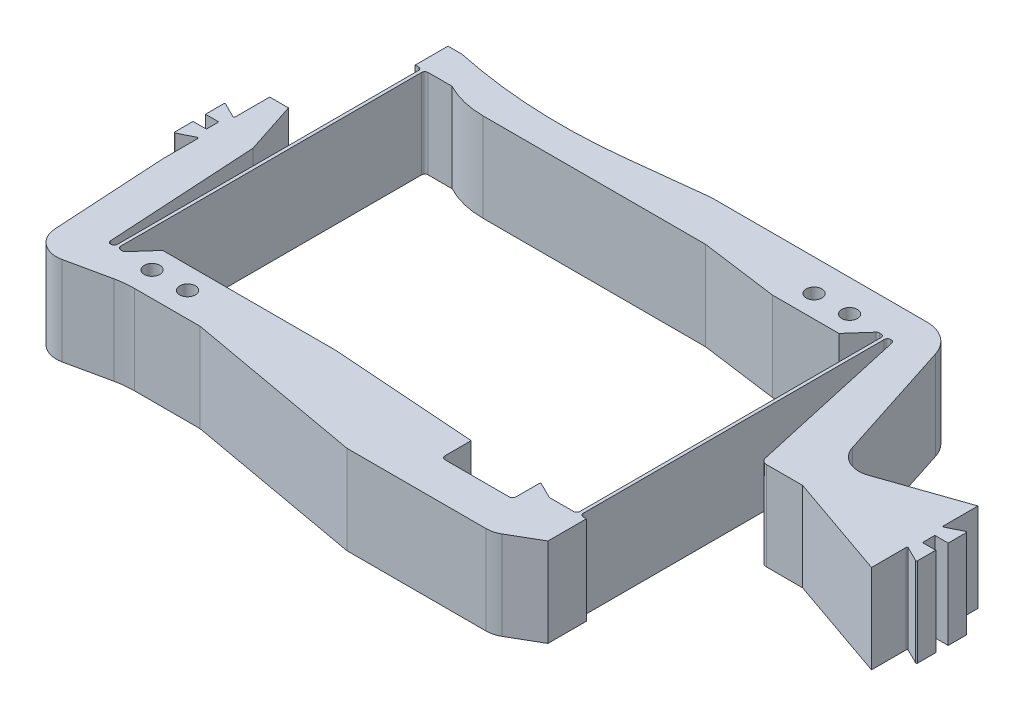
from build123d import *

# Parameters (mm, degrees)
BOSS_EXTRUDE1_DEPTH        = 6.35
BOSS_EXTRUDE1_DEPTH_BACK   = 6.35
BOSS_EXTRUDE1_2_DEPTH      = 6.35
BOSS_EXTRUDE1_2_DEPTH_BACK = 6.35
BOSS_EXTRUDE2_DEPTH        = 6.35
BOSS_EXTRUDE2_DEPTH_BACK   = 6.35
SKETCH3_W                  = 0.4572
SKETCH3_H                  = 44.508
BOSS_EXTRUDE4_DEPTH        = 6.35
BOSS_EXTRUDE4_DEPTH_BACK   = 6.35
SKETCH8_W                  = 2.032
SKETCH8_H                  = 1.778
CUT_EXTRUDE1_DEPTH         = 63.522062345
FILLET1_R                  = 0.4572
FILLET2_R                  = 0.9144
FILLET3_R                  = 3.556
FILLET6_R                  = 12.7
SKETCH9_R                  = 1.1303
CUT_EXTRUDE2_DEPTH         = 63.522062345
FILLET7_R                  = 0.127
FILLET8_R                  = 0.508
FILLET9_R                  = 76.2
SKETCH12_W                 = 3.975578287
SKETCH12_H                 = 4.68929279
SKETCH12_W_2               = 5.470600001
SKETCH12_H_2               = 8.387314833
CUT_EXTRUDE3_DEPTH         = 63.522062345
FILLET10_R                 = 0.127


with BuildPart() as part:
    # Sketch2 → Boss-Extrude1 (new, two sides: drawn at the far end of the back side and taken through both)
    with BuildSketch(Plane(origin=(0, 0, 0), x_dir=(1, 0, 0), z_dir=(0, 1, 0)).offset(-BOSS_EXTRUDE1_DEPTH_BACK)):
        with BuildLine():
            Line((9.819911786, 19.050210052), (19.344911786, 19.050210052))
            Line((19.344911786, 19.050210052), (21.965511899, 22))
            Line((21.965511899, 22), (24.251511899, 22))
            Line((24.251511899, 22), (29.687111899, -2.381342584))
            Line((29.687111899, -2.381342584), (35.584296061, -2.381342584))
            Line((35.584296061, -2.381342584), (50.68062, -7.62))
            Line((50.68062, -7.62), (50.68062, 7.62))
            Line((50.68062, 7.62), (35.584296061, 2.381342584))
            Line((35.584296061, 2.381342584), (28.784210924, 23.462125012))
            ThreePointArc((28.784210924, 23.462125012), (27.055039043, 25.850117603), (24.251511899, 26.762685167))
            Line((24.251511899, 26.762685167), (-6.638632099, 26.762685167))
            Line((-6.638632099, 26.762685167), (-30.153140375, 24.092168337))
            Line((-30.153140375, 24.092168337), (-42.245281802, 26.68929279))
            Line((-42.245281802, 26.68929279), (-48.211266614, 26.68929279))
            Line((-48.211266614, 26.68929279), (-48.211266614, 22))
            Line((-48.211266614, 22), (-38.957383068, 22))
            Line((-38.957383068, 22), (-36.496303445, 20.550210052))
            Line((-36.496303445, 20.550210052), (-1.229088214, 20.550210052))
            Line((-1.229088214, 20.550210052), (9.819911786, 19.050210052))
        make_face()
    extrude(amount=BOSS_EXTRUDE1_DEPTH + BOSS_EXTRUDE1_DEPTH_BACK)



with BuildPart() as body_2:
    # Sketch2 → Boss-Extrude1 2 (new, two sides: drawn at the far end of the back side and taken through both)
    with BuildSketch(Plane(origin=(0, 0, 0), x_dir=(1, 0, 0), z_dir=(0, 1, 0)).offset(-BOSS_EXTRUDE1_2_DEPTH_BACK)):
        Polygon((-50.68062, 7.62), (-47.994229245, 7.62), (-45.538273994, 0.064709726), (-44.235688327, -22), (-41.949688327, -22), (-39.329088214, -19.050210052), (-14.524057774, -19.050210052), (6.319911674, -20.5502101), (6.319911674, -24.799314833), (16.494911898, -24.799314833), (16.494911898, -22), (16.494911898, -20.7842203), (18.962447951, -22), (29.7221119, -22), (29.7221119, -24.341022744), (19.249626804, -30.387314833), (-1.624639293, -30.387314833), (-27.239820872, -25.774174137), (-37.984514025, -25.774174137), (-49.463347649, -28.239573642), (-50.68062, -7.62), align=None)
    extrude(amount=BOSS_EXTRUDE1_2_DEPTH + BOSS_EXTRUDE1_2_DEPTH_BACK)


with BuildPart() as part_1:
    add(part.part)

    add(body_2.part)  # Boss-Extrude2 merges body 2
    # Sketch3 → Boss-Extrude2 (add, two sides: drawn at the far end of the back side and taken through both)
    with BuildSketch(Plane(origin=(0, 0, 0), x_dir=(1, 0, 0), z_dir=(0, 1, 0)).offset(-BOSS_EXTRUDE2_DEPTH_BACK)):
        with Locations((-43.092688327, 0.254)):
            Rectangle(SKETCH3_W, SKETCH3_H)
        with Locations((23.108511899, 0.254)):
            Rectangle(SKETCH3_W, SKETCH3_H)
    extrude(amount=BOSS_EXTRUDE2_DEPTH + BOSS_EXTRUDE2_DEPTH_BACK)

    # Sketch7 → Boss-Extrude4 (add, two sides: drawn at the far end of the back side and taken through both)
    with BuildSketch(Plane(origin=(0, 0, 0), x_dir=(1, 0, 0), z_dir=(0, 1, 0)).offset(-BOSS_EXTRUDE4_DEPTH_BACK)):
        Polygon((-53.14442, 3.68670581), (-53.14442, -3.68670581), (-50.75682, -2.49290581), (-50.68062, -2.45480581), (-50.68062, 2.45480581), (-50.75682, 2.49290581), align=None)
        Polygon((50.68062, 2.45480581), (50.68062, -2.45480581), (50.75682, -2.49290581), (53.14442, -3.68670581), (53.14442, 3.68670581), (50.75682, 2.49290581), align=None)
    extrude(amount=BOSS_EXTRUDE4_DEPTH + BOSS_EXTRUDE4_DEPTH_BACK)

    # Sketch8 → Cut-Extrude1 (cut, through all)
    with BuildSketch(Plane(origin=(0, 6.35, 0), x_dir=(1, 0, 0), z_dir=(0, 1, 0))):
        with Locations((-52.25542, 0)):
            Rectangle(SKETCH8_W, SKETCH8_H)
        with Locations((52.25542, 0)):
            Rectangle(SKETCH8_W, SKETCH8_H)
    extrude(amount=-CUT_EXTRUDE1_DEPTH, mode=Mode.SUBTRACT)

    # Fillet1
    fillet1_edges = [part_1.edges().sort_by_distance(p)[0] for p in [
        (-43.321288327, 0, -22),
        (24.251511899, 0, -22),
        (21.965511899, 0, -22),
        (-42.864088327, 0, -22),
        (23.337111899, 0, -22),
        (22.879911899, 0, -22),
        (22.879911899, 0, 22),
        (23.337111899, 0, 22),
        (-44.235688327, 0, 22),
        (-41.949688327, 0, 22),
        (-42.864088327, 0, 22),
        (-43.321288327, 0, 22),
    ]]
    fillet(fillet1_edges, radius=FILLET1_R)

    # Fillet2
    fillet2_edges = [part_1.edges().sort_by_distance(p)[0] for p in [
        (29.687111899, 0, 2.381342584),
        (-48.211266614, 0, -22),
        (-48.211266614, 0, -26.68929279),
        (29.7221119, 0, 22),
        (29.7221119, 0, 24.341022744),
    ]]
    fillet(fillet2_edges, radius=FILLET2_R)

    # Fillet3
    fillet3_edges = [part_1.edges().sort_by_distance(p)[0] for p in [
        (35.584296061, 0, -2.381342584),
        (19.249626804, 0, 30.387314833),
        (-49.463347649, 0, 28.239573642),
    ]]
    fillet(fillet3_edges, radius=FILLET3_R)

    # Fillet6
    # the kernel refuses this fillet: 12.7 mm, written as the material it adds along each edge
    with BuildSketch(Plane(origin=(-37.984514025, 6.35, 25.774174137), x_dir=(1, 0, 0), z_dir=(0, -1, 0))) as fillet6_piece_1:
        with BuildLine():
            CenterArc((FILLET6_R * 0.106178254311, FILLET6_R), FILLET6_R, 257.878284844, 12.121715156)
            Line((-FILLET6_R * 0.103810874318, FILLET6_R * 0.0222962791022), (0, 0))
            Line((0, 0), (FILLET6_R * 0.106178254311, 0))
        make_face()
    extrude(amount=12.7)
    # the kernel refuses this fillet: 12.7 mm, written as the material it takes off along each edge
    with BuildSketch(Plane(origin=(-36.496303445, 14.928809219, -20.550210052), x_dir=(-0.8616133508003352, 0, -0.507565201449645), z_dir=(0, -1, 0))) as fillet6_2_piece_1:
        with BuildLine():
            CenterArc((3.489431436, 12.684211567), FILLET6_R, 239.498215304, 27.644521231)
            Line((-2.956646623, 1.741722012), (0, 0))
            Line((0, 0), (2.856361988, 0))
        make_face()
    extrude(amount=29.857618438, mode=Mode.SUBTRACT)

    # Sketch9 → Cut-Extrude2 (cut, through all)
    with BuildSketch(Plane(origin=(0, 6.35, 0), x_dir=(1, 0, 0), z_dir=(0, 1, 0))):
        with Locations(Location((-37.678088214, -22.225210052, 0), (0, 0, 270))):
            Circle(SKETCH9_R)
        with Locations(Location((-32.598088214, -22.225210052, 0), (0, 0, 270))):
            Circle(SKETCH9_R)
        with Locations(Location((12.613911786, 22.225210052, 0), (0, 0, 270))):
            Circle(SKETCH9_R)
        with Locations(Location((17.693911786, 22.225210052, 0), (0, 0, 270))):
            Circle(SKETCH9_R)
    extrude(amount=-CUT_EXTRUDE2_DEPTH, mode=Mode.SUBTRACT)

    # Fillet7
    fillet7_edges = [part_1.edges().sort_by_distance(p)[0] for p in [
        (16.494911898, 0, 20.7842203),
    ]]
    fillet(fillet7_edges, radius=FILLET7_R)

    # Fillet8
    fillet8_edges = [part_1.edges().sort_by_distance(p)[0] for p in [
        (6.319911674, 0, 24.799314833),
        (16.494911898, 0, 24.799314833),
    ]]
    fillet(fillet8_edges, radius=FILLET8_R)

    # Fillet9
    # the kernel refuses this fillet: 76.2 mm, written as the material it adds along each edge
    with BuildSketch(Plane(origin=(-30.153140375, -6.35, -24.092168337), x_dir=(-0.9777037208978189, 0, -0.20998912862945954), z_dir=(0, 1, 0))) as fillet9_piece_1_section:
        with BuildLine():
            CenterArc((FILLET9_R * 0.16376499609, -FILLET9_R), FILLET9_R, 90, 18.600972695)
            Line((-FILLET9_R * 0.155210403169, -FILLET9_R * 0.0522370050125), (0, 0))
            Line((0, 0), (FILLET9_R * 0.16376499609, 0))
        make_face()
    fillet9_piece_1 = extrude(amount=12.7, mode=Mode.PRIVATE)
    fillet9_piece_1 = split(fillet9_piece_1, bisect_by=Plane(origin=(-30.153140375, -6.35, -26.68929279), z_dir=(0, 0, 1)), keep=Keep.TOP, mode=Mode.PRIVATE)
    add(fillet9_piece_1)

    # Sketch12 → Cut-Extrude3 (cut, through all)
    with BuildSketch(Plane(origin=(0, 6.35, 0), x_dir=(1, 0, 0), z_dir=(0, 1, 0))):
        with Locations((-46.223477471, 24.344646395)):
            Rectangle(SKETCH12_W, SKETCH12_H)
        with Locations((26.9868119, -26.193657417)):
            Rectangle(SKETCH12_W_2, SKETCH12_H_2)
    extrude(amount=-CUT_EXTRUDE3_DEPTH, mode=Mode.SUBTRACT)

    # Fillet10
    fillet10_edges = [part_1.edges().sort_by_distance(p)[0] for p in [
        (50.68062, 0, -2.45480581),
        (50.68062, 0, 2.45480581),
        (53.14442, 0, 3.68670581),
        (53.14442, 0, -3.68670581),
        (-50.68062, 0, 2.45480581),
        (-50.68062, 0, -2.45480581),
        (-53.14442, 0, -3.68670581),
        (-53.14442, 0, 3.68670581),
    ]]
    fillet(fillet10_edges, radius=FILLET10_R)


solid = part_1.part
